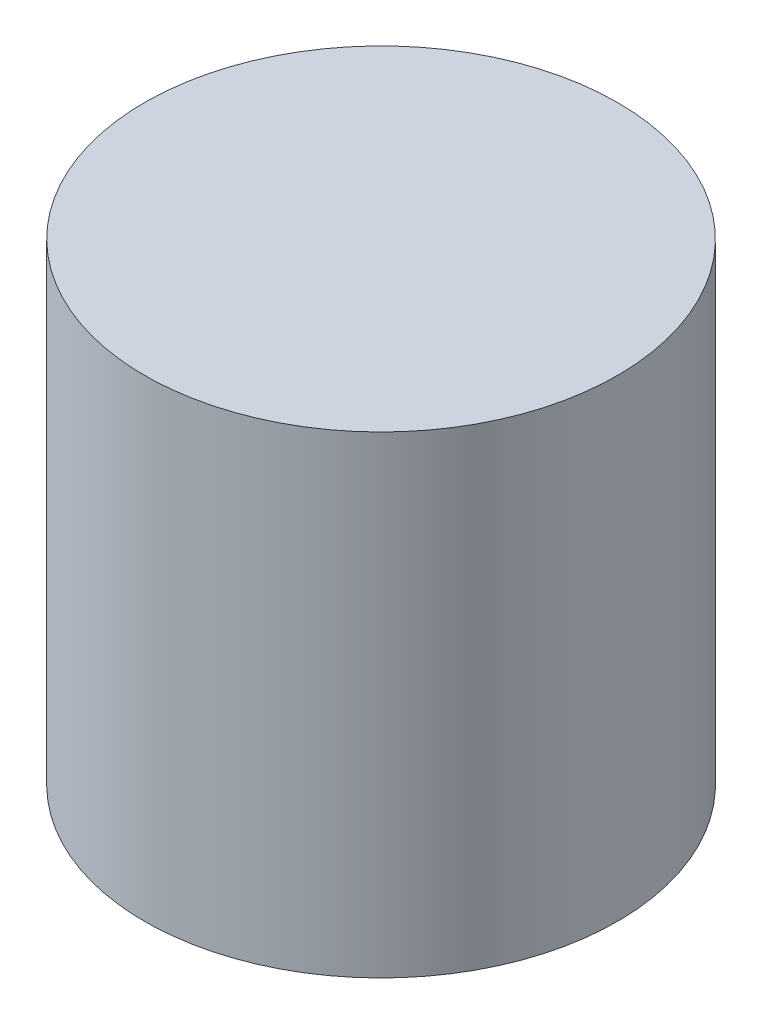
from build123d import *

# Parameters (mm, degrees)
SKETCH1_W = 6.35
SKETCH1_H = 12.7


with BuildPart() as part:
    # Sketch1 → Revolve1 (revolve)
    with BuildSketch(Plane.XY):
        with Locations((3.175, 6.35)):
            Rectangle(SKETCH1_W, SKETCH1_H)
    revolve(axis=Axis((0, 0, 0), (0, 1, 0)))


solid = part.part
